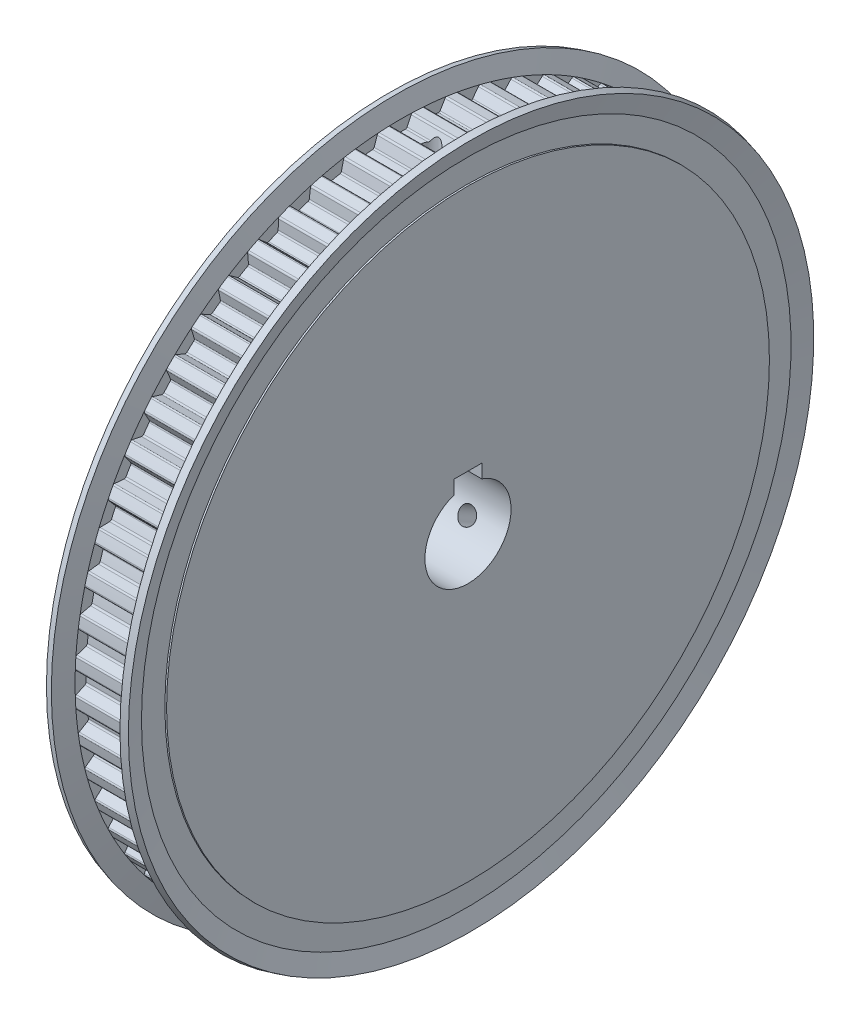
from build123d import *

# Parameters (mm, degrees)
SKETCH2_W           = 22
SKETCH2_H           = 12.5
CUT_EXTRUDE1_DEPTH  = 17
CUT_EXTRUDE2_DEPTH  = 17
CUT_EXTRUDE3_DEPTH  = 17
CUT_EXTRUDE4_DEPTH  = 17
CUT_EXTRUDE5_DEPTH  = 17
CUT_EXTRUDE6_DEPTH  = 17
CUT_EXTRUDE7_DEPTH  = 17
CUT_EXTRUDE8_DEPTH  = 17
CUT_EXTRUDE9_DEPTH  = 17
CUT_EXTRUDE10_DEPTH = 17
CUT_EXTRUDE11_DEPTH = 17
CUT_EXTRUDE12_DEPTH = 17
CUT_EXTRUDE13_DEPTH = 17
CUT_EXTRUDE14_DEPTH = 17
CUT_EXTRUDE15_DEPTH = 17
CUT_EXTRUDE16_DEPTH = 17
CUT_EXTRUDE17_DEPTH = 17
CUT_EXTRUDE18_DEPTH = 17
CUT_EXTRUDE19_DEPTH = 17
CUT_EXTRUDE20_DEPTH = 17
CUT_EXTRUDE21_DEPTH = 17
CUT_EXTRUDE22_DEPTH = 17
CUT_EXTRUDE23_DEPTH = 17
CUT_EXTRUDE24_DEPTH = 17
CUT_EXTRUDE25_DEPTH = 17
CUT_EXTRUDE26_DEPTH = 17
CUT_EXTRUDE27_DEPTH = 17
CUT_EXTRUDE28_DEPTH = 17
CUT_EXTRUDE29_DEPTH = 17
CUT_EXTRUDE30_DEPTH = 17
CUT_EXTRUDE31_DEPTH = 17
CUT_EXTRUDE32_DEPTH = 17
CUT_EXTRUDE33_DEPTH = 17
CUT_EXTRUDE34_DEPTH = 17
CUT_EXTRUDE35_DEPTH = 17
CUT_EXTRUDE36_DEPTH = 17
CUT_EXTRUDE37_DEPTH = 17
CUT_EXTRUDE38_DEPTH = 17
CUT_EXTRUDE39_DEPTH = 17
CUT_EXTRUDE40_DEPTH = 17
CUT_EXTRUDE41_DEPTH = 17
CUT_EXTRUDE42_DEPTH = 17
CUT_EXTRUDE43_DEPTH = 17
CUT_EXTRUDE44_DEPTH = 17
CUT_EXTRUDE45_DEPTH = 17
CUT_EXTRUDE46_DEPTH = 17
CUT_EXTRUDE47_DEPTH = 17
CUT_EXTRUDE48_DEPTH = 17
CUT_EXTRUDE49_DEPTH = 17
CUT_EXTRUDE50_DEPTH = 17
CUT_EXTRUDE51_DEPTH = 17
CUT_EXTRUDE52_DEPTH = 17
CUT_EXTRUDE53_DEPTH = 17
CUT_EXTRUDE54_DEPTH = 17
CUT_EXTRUDE55_DEPTH = 17
CUT_EXTRUDE56_DEPTH = 17
CUT_EXTRUDE57_DEPTH = 17
CUT_EXTRUDE58_DEPTH = 17
CUT_EXTRUDE59_DEPTH = 17
CUT_EXTRUDE60_DEPTH = 17
SKETCH63_W          = 8
SKETCH63_H          = 15.8
CUT_EXTRUDE61_DEPTH = 22
SKETCH64_W          = 2.4585
SKETCH64_H          = 94.55


with BuildPart() as part:
    # Sketch1 → Revolve1 (revolve)
    with BuildSketch(Plane.XY):
        Polygon((0, 0), (0, 87.5), (0.5, 87.5), (0.5, 94.286695005), (-0.892174751, 99.48236191), (1.039676901, 100), (2.5, 94.55), (19.5, 94.55), (20.960323099, 100), (22.892174751, 99.48236191), (21.5, 94.286695005), (21.5, 87.5), (22, 87.5), (22, 0), align=None)
    revolve(axis=Axis((22, 0, 0), (-1, 0, 0)))

    # Sketch2 → Cut-Revolve1 (revolve, cut)
    with BuildSketch(Plane.XY):
        with Locations((11, 6.25)):
            Rectangle(SKETCH2_W, SKETCH2_H)
    revolve(axis=Axis((22, 0, 0), (-1, 0, 0)), mode=Mode.SUBTRACT)

    # Sketch3 → Cut-Extrude1 (cut)
    with BuildSketch(Plane(origin=(2.5, 0, 0), x_dir=(0, 0, -1), z_dir=(1, 0, 0))):
        with BuildLine():
            Line((-3.54151607, 95.429307285), (-3.506469914, 94.484957368))
            ThreePointArc((-3.506469914, 94.484957368), (-3.2271442, 94.411906934), (-3.034773081, 94.196610457))
            Line((-3.034773081, 94.196610457), (-1.864496216, 91.686943622))
            ThreePointArc((-1.864496216, 91.686943622), (-1.639448718, 91.432177473), (-1.312093524, 91.340576474))
            ThreePointArc((-1.312093524, 91.340576474), (0.032179434, 91.349994332), (1.376445422, 91.339629395))
            ThreePointArc((1.376445422, 91.339629395), (1.649444404, 91.415864837), (1.837133226, 91.628263501))
            Line((1.837133226, 91.628263501), (3.006723314, 94.136457539))
            ThreePointArc((3.006723314, 94.136457539), (3.237749407, 94.39492376), (3.573182864, 94.482457971))
            Line((3.573182864, 94.482457971), (3.608895797, 95.426782908))
            ThreePointArc((3.608895797, 95.426782908), (0.033713499, 95.494994049), (-3.54151607, 95.429307285))
        make_face()
    extrude(amount=CUT_EXTRUDE1_DEPTH, mode=Mode.SUBTRACT)

    # Sketch4 → Cut-Extrude2 (cut)
    with BuildSketch(Plane(origin=(2.5, 0, 0), x_dir=(0, 0, -1), z_dir=(1, 0, 0))):
        with BuildLine():
            Line((6.452963567, 95.276724787), (6.389106291, 94.333884797))
            ThreePointArc((6.389106291, 94.333884797), (6.65926598, 94.232037053), (6.82807866, 93.997811736))
            Line((6.82807866, 93.997811736), (7.729613008, 91.379565875))
            ThreePointArc((7.729613008, 91.379565875), (7.926797358, 91.102671493), (8.242784355, 90.977354359))
            ThreePointArc((8.242784355, 90.977354359), (9.580677678, 90.846205838), (10.916496206, 90.695383623))
            ThreePointArc((10.916496206, 90.695383623), (11.195968445, 90.742665275), (11.404830794, 90.934281573))
            Line((11.404830794, 90.934281573), (12.830191413, 93.306480008))
            ThreePointArc((12.830191413, 93.306480008), (13.086968998, 93.539381521), (13.429714732, 93.591373866))
            Line((13.429714732, 93.591373866), (13.563940861, 94.526792675))
            ThreePointArc((13.563940861, 94.526792675), (10.015473791, 94.968338459), (6.452963567, 95.276724787))
        make_face()
    extrude(amount=CUT_EXTRUDE2_DEPTH, mode=Mode.SUBTRACT)

    # Sketch5 → Cut-Extrude3 (cut)
    with BuildSketch(Plane(origin=(2.5, 0, 0), x_dir=(0, 0, -1), z_dir=(1, 0, 0))):
        with BuildLine():
            Line((16.376743184, 94.080270555), (16.21468211, 93.149270443))
            ThreePointArc((16.21468211, 93.149270443), (16.472715848, 93.019741255), (16.616120542, 92.769153319))
            Line((16.616120542, 92.769153319), (17.239034974, 90.071014483))
            ThreePointArc((17.239034974, 90.071014483), (17.406195783, 89.77502558), (17.707352563, 89.617365311))
            ThreePointArc((17.707352563, 89.617365311), (19.024208014, 89.347087303), (20.336943573, 89.05746025))
            ThreePointArc((20.336943573, 89.05746025), (20.619827112, 89.075270084), (20.847574648, 89.244004628))
            Line((20.847574648, 89.244004628), (22.51308925, 91.454217156))
            ThreePointArc((22.51308925, 91.454217156), (22.792805018, 91.659002243), (23.139107835, 91.674883085))
            Line((23.139107835, 91.674883085), (23.370376549, 92.59114712))
            ThreePointArc((23.370376549, 92.59114712), (19.887502456, 93.40118988), (16.376743184, 94.080270555))
        make_face()
    extrude(amount=CUT_EXTRUDE3_DEPTH, mode=Mode.SUBTRACT)

    # Sketch6 → Cut-Extrude4 (cut)
    with BuildSketch(Plane(origin=(2.5, 0, 0), x_dir=(0, 0, -1), z_dir=(1, 0, 0))):
        with BuildLine():
            Line((26.121095777, 91.853053191), (25.862606479, 90.94409319))
            ThreePointArc((25.862606479, 90.94409319), (26.105687194, 90.788301707), (26.22211273, 90.524096644))
            Line((26.22211273, 90.524096644), (26.559582466, 87.775626207))
            ThreePointArc((26.559582466, 87.775626207), (26.694888285, 87.4637857), (26.977915311, 87.275509655))
            ThreePointArc((26.977915311, 87.275509655), (28.259305145, 86.869063381), (29.534575131, 86.443804705))
            ThreePointArc((29.534575131, 86.443804705), (29.817770639, 86.431947593), (30.061908113, 86.575951692))
            Line((30.061908113, 86.575951692), (31.949328971, 88.599962762))
            ThreePointArc((31.949328971, 88.599962762), (32.248918296, 88.774387757), (32.59498403, 88.7539831))
            Line((32.59498403, 88.7539831), (32.920761502, 89.641053581))
            ThreePointArc((32.920761502, 89.641053581), (29.541639482, 90.81071832), (26.121095777, 91.853053191))
        make_face()
    extrude(amount=CUT_EXTRUDE4_DEPTH, mode=Mode.SUBTRACT)

    # Sketch7 → Cut-Extrude5 (cut)
    with BuildSketch(Plane(origin=(2.5, 0, 0), x_dir=(0, 0, -1), z_dir=(1, 0, 0))):
        with BuildLine():
            Line((35.579260177, 88.619474554), (35.227174719, 87.74251342))
            ThreePointArc((35.227174719, 87.74251342), (35.452639168, 87.562166526), (35.540809964, 87.287239024))
            Line((35.540809964, 87.287239024), (35.589137614, 84.518549803))
            ThreePointArc((35.589137614, 84.518549803), (35.691106005, 84.194274281), (35.952902373, 83.977445251))
            ThreePointArc((35.952902373, 83.977445251), (37.184787415, 83.439283823), (38.408619703, 82.883052746))
            ThreePointArc((38.408619703, 82.883052746), (38.68902443, 82.841658598), (38.946877021, 82.959354512))
            Line((38.946877021, 82.959354512), (41.035525157, 84.774988636))
            ThreePointArc((41.035525157, 84.774988636), (41.351705677, 84.9171425), (41.69374276, 84.860675903))
            Line((41.69374276, 84.860675903), (42.110459702, 85.708833901))
            ThreePointArc((42.110459702, 85.708833901), (38.872112124, 87.225305525), (35.579260177, 88.619474554))
        make_face()
    extrude(amount=CUT_EXTRUDE5_DEPTH, mode=Mode.SUBTRACT)

    # Sketch8 → Cut-Extrude6 (cut)
    with BuildSketch(Plane(origin=(2.5, 0, 0), x_dir=(0, 0, -1), z_dir=(1, 0, 0))):
        with BuildLine():
            Line((44.647610758, 84.41496241), (44.205786661, 83.579608313))
            ThreePointArc((44.205786661, 83.579608313), (44.411164609, 83.376681925), (44.470114646, 83.094044147))
            Line((44.470114646, 83.094044147), (44.228770723, 80.33547048))
            ThreePointArc((44.228770723, 80.33547048), (44.296284498, 80.002312774), (44.533981913, 79.759306385))
            ThreePointArc((44.533981913, 79.759306385), (45.702865373, 79.09532601), (46.8618514, 78.414216717))
            ThreePointArc((46.8618514, 78.414216717), (47.136393174, 78.343739055), (47.405135794, 78.433837284))
            Line((47.405135794, 78.433837284), (49.672127542, 80.021201994))
            ThreePointArc((49.672127542, 80.021201994), (50.001435117, 80.129527261), (50.335696118, 80.037617383))
            Line((50.335696118, 80.037617383), (50.838786894, 80.837570301))
            ThreePointArc((50.838786894, 80.837570301), (47.776693771, 82.684234031), (44.647610758, 84.41496241))
        make_face()
    extrude(amount=CUT_EXTRUDE6_DEPTH, mode=Mode.SUBTRACT)

    # Sketch9 → Cut-Extrude7 (cut)
    with BuildSketch(Plane(origin=(2.5, 0, 0), x_dir=(0, 0, -1), z_dir=(1, 0, 0))):
        with BuildLine():
            Line((53.226792772, 79.285582272), (52.700070754, 78.500987526))
            ThreePointArc((52.700070754, 78.500987526), (52.883112036, 78.277704949), (52.912195447, 77.990453533))
            Line((52.912195447, 77.990453533), (52.383824164, 75.272218931))
            ThreePointArc((52.383824164, 75.272218931), (52.416143629, 74.933829187), (52.627137828, 74.667307866))
            ThreePointArc((52.627137828, 74.667307866), (53.720213174, 73.884783254), (54.801654847, 73.086258121))
            ThreePointArc((54.801654847, 73.086258121), (55.06732573, 72.987469113), (55.34401398, 73.048982521))
            Line((55.34401398, 73.048982521), (57.764511703, 74.390686318))
            ThreePointArc((57.764511703, 74.390686318), (58.103338371, 74.463996152), (58.426161057, 74.337649977))
            Line((58.426161057, 74.337649977), (59.010113698, 75.080633364))
            ThreePointArc((59.010113698, 75.080633364), (56.157823964, 77.237256766), (53.226792772, 79.285582272))
        make_face()
    extrude(amount=CUT_EXTRUDE7_DEPTH, mode=Mode.SUBTRACT)

    # Sketch10 → Cut-Extrude8 (cut)
    with BuildSketch(Plane(origin=(2.5, 0, 0), x_dir=(0, 0, -1), z_dir=(1, 0, 0))):
        with BuildLine():
            Line((61.222810906, 73.287532703), (60.616961843, 72.562293493))
            ThreePointArc((60.616961843, 72.562293493), (60.775661021, 72.321101057), (60.774559161, 72.03238319))
            Line((60.774559161, 72.03238319), (59.964949466, 69.3842692))
            ThreePointArc((59.964949466, 69.3842692), (59.961720521, 69.044354886), (60.143699809, 68.757238698))
            ThreePointArc((60.143699809, 68.757238698), (61.148991078, 67.864743351), (62.141039895, 66.957551186))
            ThreePointArc((62.141039895, 66.957551186), (62.394929143, 66.831533186), (62.676531567, 66.863787819))
            Line((62.676531567, 66.863787819), (65.224015786, 67.945130715))
            ThreePointArc((65.224015786, 67.945130715), (65.56864929, 67.982621919), (65.876496749, 67.823223723))
            Line((65.876496749, 67.823223723), (66.534913347, 68.501097297))
            ThreePointArc((66.534913347, 68.501097297), (63.923677285, 70.944051952), (61.222810906, 73.287532703))
        make_face()
    extrude(amount=CUT_EXTRUDE8_DEPTH, mode=Mode.SUBTRACT)

    # Sketch11 → Cut-Extrude9 (cut)
    with BuildSketch(Plane(origin=(2.5, 0, 0), x_dir=(0, 0, -1), z_dir=(1, 0, 0))):
        with BuildLine():
            Line((68.548059113, 66.48652959), (67.869720814, 65.828591787))
            ThreePointArc((67.869720814, 65.828591787), (68.002339147, 65.572132047), (67.971064087, 65.285110984))
            Line((67.971064087, 65.285110984), (66.889086233, 62.736130896))
            ThreePointArc((66.889086233, 62.736130896), (66.850344256, 62.398416185), (67.001314828, 62.093850834))
            ThreePointArc((67.001314828, 62.093850834), (67.907807839, 61.101163119), (68.799594706, 60.095243309))
            ThreePointArc((68.799594706, 60.095243309), (69.038920654, 59.943376995), (69.322351958, 59.946019465))
            Line((69.322351958, 59.946019465), (71.968911904, 60.755154041))
            ThreePointArc((71.968911904, 60.755154041), (72.315576367, 60.756415855), (72.605075756, 60.565712036))
            Line((72.605075756, 60.565712036), (73.330742563, 61.171048872))
            ThreePointArc((73.330742563, 61.171048872), (70.989169421, 63.87356926), (68.548059113, 66.48652959))
        make_face()
    extrude(amount=CUT_EXTRUDE9_DEPTH, mode=Mode.SUBTRACT)

    # Sketch12 → Cut-Extrude10 (cut)
    with BuildSketch(Plane(origin=(2.5, 0, 0), x_dir=(0, 0, -1), z_dir=(1, 0, 0))):
        with BuildLine():
            Line((75.122280438, 58.957086145), (74.37888492, 58.373658255))
            ThreePointArc((74.37888492, 58.373658255), (74.483969414, 58.104741038), (74.422863812, 57.822561439))
            Line((74.422863812, 57.822561439), (73.080372174, 55.400642413))
            ThreePointArc((73.080372174, 55.400642413), (73.00654163, 55.068827378), (73.124849421, 54.750149746))
            ThreePointArc((73.124849421, 54.750149746), (73.922612447, 53.668145757), (74.70436676, 52.57451937))
            ThreePointArc((74.70436676, 52.57451937), (74.926507303, 52.398468622), (75.208662154, 52.371469978))
            Line((75.208662154, 52.371469978), (77.925301561, 52.899531186))
            ThreePointArc((77.925301561, 52.899531186), (78.270198856, 52.864549783), (78.53817836, 52.644629734))
            Line((78.53817836, 52.644629734), (79.323144818, 53.170797636))
            ThreePointArc((79.323144818, 53.170797636), (77.276889361, 56.103274376), (75.122280438, 58.957086145))
        make_face()
    extrude(amount=CUT_EXTRUDE10_DEPTH, mode=Mode.SUBTRACT)

    # Sketch13 → Cut-Extrude11 (cut)
    with BuildSketch(Plane(origin=(2.5, 0, 0), x_dir=(0, 0, -1), z_dir=(1, 0, 0))):
        with BuildLine():
            Line((80.873446339, 50.781696527), (80.073138399, 50.279170707))
            ThreePointArc((80.073138399, 50.279170707), (80.149537725, 50.000742326), (80.059271066, 49.726495811))
            Line((80.059271066, 49.726495811), (78.470974264, 47.458172899))
            ThreePointArc((78.470974264, 47.458172899), (78.362864056, 47.135892975), (78.447212861, 46.806594561))
            ThreePointArc((78.447212861, 46.806594561), (79.127505444, 45.647128959), (79.790662139, 44.477777995))
            ThreePointArc((79.790662139, 44.477777995), (79.993183459, 44.279471662), (80.27097051, 44.223127707))
            Line((80.27097051, 44.223127707), (83.027925309, 44.464329997))
            ThreePointArc((83.027925309, 44.464329997), (83.367276668, 44.393488642), (83.610800247, 44.146761852))
            Line((83.610800247, 44.146761852), (84.446466098, 44.587996014))
            ThreePointArc((84.446466098, 44.587996014), (82.71794753, 47.718300278), (80.873446339, 50.781696527))
        make_face()
    extrude(amount=CUT_EXTRUDE11_DEPTH, mode=Mode.SUBTRACT)

    # Sketch14 → Cut-Extrude12 (cut)
    with BuildSketch(Plane(origin=(2.5, 0, 0), x_dir=(0, 0, -1), z_dir=(1, 0, 0))):
        with BuildLine():
            Line((85.738545839, 42.049932015), (84.890093817, 41.633814043))
            ThreePointArc((84.890093817, 41.633814043), (84.936970929, 41.348925018), (84.818532193, 41.085616289))
            Line((84.818532193, 41.085616289), (83.001831939, 38.995741711))
            ThreePointArc((83.001831939, 38.995741711), (82.860626544, 38.686527864), (82.910092221, 38.35021653))
            ThreePointArc((82.910092221, 38.35021653), (83.465460933, 37.125992664), (84.002754327, 35.893728777))
            ThreePointArc((84.002754327, 35.893728777), (84.183437558, 35.675339545), (84.453813314, 35.590267594))
            Line((84.453813314, 35.590267594), (87.220877731, 35.541968305))
            ThreePointArc((87.220877731, 35.541968305), (87.55096515, 35.43604315), (87.76736471, 35.165212809))
            Line((87.76736471, 35.165212809), (88.644574225, 35.516678977))
            ThreePointArc((88.644574225, 35.516678977), (87.252730557, 38.810514496), (85.738545839, 42.049932015))
        make_face()
    extrude(amount=CUT_EXTRUDE12_DEPTH, mode=Mode.SUBTRACT)

    # Sketch15 → Cut-Extrude13 (cut)
    with BuildSketch(Plane(origin=(2.5, 0, 0), x_dir=(0, 0, -1), z_dir=(1, 0, 0))):
        with BuildLine():
            Line((89.664275888, 32.857459648), (88.776975603, 32.5323086))
            ThreePointArc((88.776975603, 32.5323086), (88.793816905, 32.244080234), (88.648503732, 31.994594158))
            Line((88.648503732, 31.994594158), (86.623304174, 30.106065017))
            ThreePointArc((86.623304174, 30.106065017), (86.450550669, 29.813305059), (86.464591261, 29.473665502))
            ThreePointArc((86.464591261, 29.473665502), (86.888951365, 28.198096225), (87.294494759, 26.916420355))
            ThreePointArc((87.294494759, 26.916420355), (87.451360298, 26.680340941), (87.711362467, 26.567473061))
            Line((87.711362467, 26.567473061), (90.458219965, 26.230201369))
            ThreePointArc((90.458219965, 26.230201369), (90.775426937, 26.090352953), (90.962331558, 25.798386336))
            Line((90.962331558, 25.798386336), (91.871473846, 26.056233772))
            ThreePointArc((91.871473846, 26.056233772), (90.831554408, 29.477512596), (89.664275888, 32.857459648))
        make_face()
    extrude(amount=CUT_EXTRUDE13_DEPTH, mode=Mode.SUBTRACT)

    # Sketch16 → Cut-Extrude14 (cut)
    with BuildSketch(Plane(origin=(2.5, 0, 0), x_dir=(0, 0, -1), z_dir=(1, 0, 0))):
        with BuildLine():
            Line((92.607625366, 23.304994078), (91.691198266, 23.074372376))
            ThreePointArc((91.691198266, 23.074372376), (91.677819241, 22.78596256), (91.507223714, 22.553032557))
            Line((91.507223714, 22.553032557), (89.295713362, 20.886539974))
            ThreePointArc((89.295713362, 20.886539974), (89.09330447, 20.613441444), (89.071766145, 20.274194827))
            ThreePointArc((89.071766145, 20.274194827), (89.360468264, 18.961255542), (89.62981844, 17.644209999))
            ThreePointArc((89.62981844, 17.644209999), (89.761147634, 17.39302694), (90.007927578, 17.253599734))
            Line((90.007927578, 17.253599734), (92.704483012, 16.631050859))
            ThreePointArc((92.704483012, 16.631050859), (93.005334151, 16.458811389), (93.160696067, 16.148907343))
            Line((93.160696067, 16.148907343), (94.091810374, 16.310311018))
            ThreePointArc((94.091810374, 16.310311018), (93.415208742, 19.821548899), (92.607625366, 23.304994078))
        make_face()
    extrude(amount=CUT_EXTRUDE14_DEPTH, mode=Mode.SUBTRACT)

    # Sketch17 → Cut-Extrude15 (cut)
    with BuildSketch(Plane(origin=(2.5, 0, 0), x_dir=(0, 0, -1), z_dir=(1, 0, 0))):
        with BuildLine():
            Line((94.536346322, 13.497194116), (93.600832973, 13.3636285))
            ThreePointArc((93.600832973, 13.3636285), (93.557380206, 13.078197112), (93.363371403, 12.864375212))
            Line((93.363371403, 12.864375212), (90.989780027, 11.438177629))
            ThreePointArc((90.989780027, 11.438177629), (90.759933383, 11.187732651), (90.703052119, 10.852595831))
            ThreePointArc((90.703052119, 10.852595831), (90.852933172, 9.516671376), (90.983139073, 8.178685986))
            ThreePointArc((90.983139073, 8.178685986), (91.087493053, 7.915151295), (91.318346999, 7.750692358))
            Line((91.318346999, 7.750692358), (93.935056343, 6.849687075))
            ThreePointArc((93.935056343, 6.849687075), (94.216255461, 6.646943644), (94.338372494, 6.322497543))
            Line((94.338372494, 6.322497543), (95.281257338, 6.385689083))
            ThreePointArc((95.281257338, 6.385689083), (94.9753865, 9.948416164), (94.536346322, 13.497194116))
        make_face()
    extrude(amount=CUT_EXTRUDE15_DEPTH, mode=Mode.SUBTRACT)

    # Sketch18 → Cut-Extrude16 (cut)
    with BuildSketch(Plane(origin=(2.5, 0, 0), x_dir=(0, 0, -1), z_dir=(1, 0, 0))):
        with BuildLine():
            Line((95.429307285, 3.54151607), (94.484957368, 3.506469914))
            ThreePointArc((94.484957368, 3.506469914), (94.411906934, 3.2271442), (94.196610457, 3.034773081))
            Line((94.196610457, 3.034773081), (91.686943622, 1.864496216))
            ThreePointArc((91.686943622, 1.864496216), (91.432177473, 1.639448718), (91.340576474, 1.312093524))
            ThreePointArc((91.340576474, 1.312093524), (91.349994332, -0.032179434), (91.339629395, -1.376445422))
            ThreePointArc((91.339629395, -1.376445422), (91.415864837, -1.649444404), (91.628263501, -1.837133226))
            Line((91.628263501, -1.837133226), (94.136457539, -3.006723314))
            ThreePointArc((94.136457539, -3.006723314), (94.39492376, -3.237749407), (94.482457971, -3.573182864))
            Line((94.482457971, -3.573182864), (95.426782908, -3.608895797))
            ThreePointArc((95.426782908, -3.608895797), (95.494994049, -0.033713499), (95.429307285, 3.54151607))
        make_face()
    extrude(amount=CUT_EXTRUDE16_DEPTH, mode=Mode.SUBTRACT)

    # Sketch19 → Cut-Extrude17 (cut)
    with BuildSketch(Plane(origin=(2.5, 0, 0), x_dir=(0, 0, -1), z_dir=(1, 0, 0))):
        with BuildLine():
            Line((95.276724787, -6.452963567), (94.333884797, -6.389106291))
            ThreePointArc((94.333884797, -6.389106291), (94.232037053, -6.65926598), (93.997811736, -6.82807866))
            Line((93.997811736, -6.82807866), (91.379565875, -7.729613008))
            ThreePointArc((91.379565875, -7.729613008), (91.102671493, -7.926797358), (90.977354359, -8.242784355))
            ThreePointArc((90.977354359, -8.242784355), (90.846205838, -9.580677678), (90.695383623, -10.916496206))
            ThreePointArc((90.695383623, -10.916496206), (90.742665275, -11.195968445), (90.934281573, -11.404830794))
            Line((90.934281573, -11.404830794), (93.306480008, -12.830191413))
            ThreePointArc((93.306480008, -12.830191413), (93.539381521, -13.086968998), (93.591373866, -13.429714732))
            Line((93.591373866, -13.429714732), (94.526792675, -13.563940861))
            ThreePointArc((94.526792675, -13.563940861), (94.968338459, -10.015473791), (95.276724787, -6.452963567))
        make_face()
    extrude(amount=CUT_EXTRUDE17_DEPTH, mode=Mode.SUBTRACT)

    # Sketch20 → Cut-Extrude18 (cut)
    with BuildSketch(Plane(origin=(2.5, 0, 0), x_dir=(0, 0, -1), z_dir=(1, 0, 0))):
        with BuildLine():
            Line((94.080270555, -16.376743184), (93.149270443, -16.21468211))
            ThreePointArc((93.149270443, -16.21468211), (93.019741255, -16.472715848), (92.769153319, -16.616120542))
            Line((92.769153319, -16.616120542), (90.071014483, -17.239034974))
            ThreePointArc((90.071014483, -17.239034974), (89.77502558, -17.406195783), (89.617365311, -17.707352563))
            ThreePointArc((89.617365311, -17.707352563), (89.347087303, -19.024208014), (89.05746025, -20.336943573))
            ThreePointArc((89.05746025, -20.336943573), (89.075270084, -20.619827112), (89.244004628, -20.847574648))
            Line((89.244004628, -20.847574648), (91.454217156, -22.51308925))
            ThreePointArc((91.454217156, -22.51308925), (91.659002243, -22.792805018), (91.674883085, -23.139107835))
            Line((91.674883085, -23.139107835), (92.59114712, -23.370376549))
            ThreePointArc((92.59114712, -23.370376549), (93.40118988, -19.887502456), (94.080270555, -16.376743184))
        make_face()
    extrude(amount=CUT_EXTRUDE18_DEPTH, mode=Mode.SUBTRACT)

    # Sketch21 → Cut-Extrude19 (cut)
    with BuildSketch(Plane(origin=(2.5, 0, 0), x_dir=(0, 0, -1), z_dir=(1, 0, 0))):
        with BuildLine():
            Line((91.853053191, -26.121095777), (90.94409319, -25.862606479))
            ThreePointArc((90.94409319, -25.862606479), (90.788301707, -26.105687194), (90.524096644, -26.22211273))
            Line((90.524096644, -26.22211273), (87.775626207, -26.559582466))
            ThreePointArc((87.775626207, -26.559582466), (87.4637857, -26.694888285), (87.275509655, -26.977915311))
            ThreePointArc((87.275509655, -26.977915311), (86.869063381, -28.259305145), (86.443804705, -29.534575131))
            ThreePointArc((86.443804705, -29.534575131), (86.431947593, -29.817770639), (86.575951692, -30.061908113))
            Line((86.575951692, -30.061908113), (88.599962762, -31.949328971))
            ThreePointArc((88.599962762, -31.949328971), (88.774387757, -32.248918296), (88.7539831, -32.59498403))
            Line((88.7539831, -32.59498403), (89.641053581, -32.920761502))
            ThreePointArc((89.641053581, -32.920761502), (90.81071832, -29.541639482), (91.853053191, -26.121095777))
        make_face()
    extrude(amount=CUT_EXTRUDE19_DEPTH, mode=Mode.SUBTRACT)

    # Sketch22 → Cut-Extrude20 (cut)
    with BuildSketch(Plane(origin=(2.5, 0, 0), x_dir=(0, 0, -1), z_dir=(1, 0, 0))):
        with BuildLine():
            Line((88.619474554, -35.579260177), (87.74251342, -35.227174719))
            ThreePointArc((87.74251342, -35.227174719), (87.562166526, -35.452639168), (87.287239024, -35.540809964))
            Line((87.287239024, -35.540809964), (84.518549803, -35.589137614))
            ThreePointArc((84.518549803, -35.589137614), (84.194274281, -35.691106005), (83.977445251, -35.952902373))
            ThreePointArc((83.977445251, -35.952902373), (83.439283823, -37.184787415), (82.883052746, -38.408619703))
            ThreePointArc((82.883052746, -38.408619703), (82.841658598, -38.68902443), (82.959354512, -38.946877021))
            Line((82.959354512, -38.946877021), (84.774988636, -41.035525157))
            ThreePointArc((84.774988636, -41.035525157), (84.9171425, -41.351705677), (84.860675903, -41.69374276))
            Line((84.860675903, -41.69374276), (85.708833901, -42.110459702))
            ThreePointArc((85.708833901, -42.110459702), (87.225305525, -38.872112124), (88.619474554, -35.579260177))
        make_face()
    extrude(amount=CUT_EXTRUDE20_DEPTH, mode=Mode.SUBTRACT)

    # Sketch23 → Cut-Extrude21 (cut)
    with BuildSketch(Plane(origin=(2.5, 0, 0), x_dir=(0, 0, -1), z_dir=(1, 0, 0))):
        with BuildLine():
            Line((84.41496241, -44.647610758), (83.579608313, -44.205786661))
            ThreePointArc((83.579608313, -44.205786661), (83.376681925, -44.411164609), (83.094044147, -44.470114646))
            Line((83.094044147, -44.470114646), (80.33547048, -44.228770723))
            ThreePointArc((80.33547048, -44.228770723), (80.002312774, -44.296284498), (79.759306385, -44.533981913))
            ThreePointArc((79.759306385, -44.533981913), (79.09532601, -45.702865373), (78.414216717, -46.8618514))
            ThreePointArc((78.414216717, -46.8618514), (78.343739055, -47.136393174), (78.433837284, -47.405135794))
            Line((78.433837284, -47.405135794), (80.021201994, -49.672127542))
            ThreePointArc((80.021201994, -49.672127542), (80.129527261, -50.001435117), (80.037617383, -50.335696118))
            Line((80.037617383, -50.335696118), (80.837570301, -50.838786894))
            ThreePointArc((80.837570301, -50.838786894), (82.684234031, -47.776693771), (84.41496241, -44.647610758))
        make_face()
    extrude(amount=CUT_EXTRUDE21_DEPTH, mode=Mode.SUBTRACT)

    # Sketch24 → Cut-Extrude22 (cut)
    with BuildSketch(Plane(origin=(2.5, 0, 0), x_dir=(0, 0, -1), z_dir=(1, 0, 0))):
        with BuildLine():
            Line((79.285582272, -53.226792772), (78.500987526, -52.700070754))
            ThreePointArc((78.500987526, -52.700070754), (78.277704949, -52.883112036), (77.990453533, -52.912195447))
            Line((77.990453533, -52.912195447), (75.272218931, -52.383824164))
            ThreePointArc((75.272218931, -52.383824164), (74.933829187, -52.416143629), (74.667307866, -52.627137828))
            ThreePointArc((74.667307866, -52.627137828), (73.884783254, -53.720213174), (73.086258121, -54.801654847))
            ThreePointArc((73.086258121, -54.801654847), (72.987469113, -55.06732573), (73.048982521, -55.34401398))
            Line((73.048982521, -55.34401398), (74.390686318, -57.764511703))
            ThreePointArc((74.390686318, -57.764511703), (74.463996152, -58.103338371), (74.337649977, -58.426161057))
            Line((74.337649977, -58.426161057), (75.080633364, -59.010113698))
            ThreePointArc((75.080633364, -59.010113698), (77.237256766, -56.157823964), (79.285582272, -53.226792772))
        make_face()
    extrude(amount=CUT_EXTRUDE22_DEPTH, mode=Mode.SUBTRACT)

    # Sketch25 → Cut-Extrude23 (cut)
    with BuildSketch(Plane(origin=(2.5, 0, 0), x_dir=(0, 0, -1), z_dir=(1, 0, 0))):
        with BuildLine():
            Line((73.287532703, -61.222810906), (72.562293493, -60.616961843))
            ThreePointArc((72.562293493, -60.616961843), (72.321101057, -60.775661021), (72.03238319, -60.774559161))
            Line((72.03238319, -60.774559161), (69.3842692, -59.964949466))
            ThreePointArc((69.3842692, -59.964949466), (69.044354886, -59.961720521), (68.757238698, -60.143699809))
            ThreePointArc((68.757238698, -60.143699809), (67.864743351, -61.148991078), (66.957551186, -62.141039895))
            ThreePointArc((66.957551186, -62.141039895), (66.831533186, -62.394929143), (66.863787819, -62.676531567))
            Line((66.863787819, -62.676531567), (67.945130715, -65.224015786))
            ThreePointArc((67.945130715, -65.224015786), (67.982621919, -65.56864929), (67.823223723, -65.876496749))
            Line((67.823223723, -65.876496749), (68.501097297, -66.534913347))
            ThreePointArc((68.501097297, -66.534913347), (70.944051952, -63.923677285), (73.287532703, -61.222810906))
        make_face()
    extrude(amount=CUT_EXTRUDE23_DEPTH, mode=Mode.SUBTRACT)

    # Sketch26 → Cut-Extrude24 (cut)
    with BuildSketch(Plane(origin=(2.5, 0, 0), x_dir=(0, 0, -1), z_dir=(1, 0, 0))):
        with BuildLine():
            Line((66.48652959, -68.548059113), (65.828591787, -67.869720814))
            ThreePointArc((65.828591787, -67.869720814), (65.572132047, -68.002339147), (65.285110984, -67.971064087))
            Line((65.285110984, -67.971064087), (62.736130896, -66.889086233))
            ThreePointArc((62.736130896, -66.889086233), (62.398416185, -66.850344256), (62.093850834, -67.001314828))
            ThreePointArc((62.093850834, -67.001314828), (61.101163119, -67.907807839), (60.095243309, -68.799594706))
            ThreePointArc((60.095243309, -68.799594706), (59.943376995, -69.038920654), (59.946019465, -69.322351958))
            Line((59.946019465, -69.322351958), (60.755154041, -71.968911904))
            ThreePointArc((60.755154041, -71.968911904), (60.756415855, -72.315576367), (60.565712036, -72.605075756))
            Line((60.565712036, -72.605075756), (61.171048872, -73.330742563))
            ThreePointArc((61.171048872, -73.330742563), (63.87356926, -70.989169421), (66.48652959, -68.548059113))
        make_face()
    extrude(amount=CUT_EXTRUDE24_DEPTH, mode=Mode.SUBTRACT)

    # Sketch27 → Cut-Extrude25 (cut)
    with BuildSketch(Plane(origin=(2.5, 0, 0), x_dir=(0, 0, -1), z_dir=(1, 0, 0))):
        with BuildLine():
            Line((58.957086145, -75.122280438), (58.373658255, -74.37888492))
            ThreePointArc((58.373658255, -74.37888492), (58.104741038, -74.483969414), (57.822561439, -74.422863812))
            Line((57.822561439, -74.422863812), (55.400642413, -73.080372174))
            ThreePointArc((55.400642413, -73.080372174), (55.068827378, -73.00654163), (54.750149746, -73.124849421))
            ThreePointArc((54.750149746, -73.124849421), (53.668145757, -73.922612447), (52.57451937, -74.70436676))
            ThreePointArc((52.57451937, -74.70436676), (52.398468622, -74.926507303), (52.371469978, -75.208662154))
            Line((52.371469978, -75.208662154), (52.899531186, -77.925301561))
            ThreePointArc((52.899531186, -77.925301561), (52.864549783, -78.270198856), (52.644629734, -78.53817836))
            Line((52.644629734, -78.53817836), (53.170797636, -79.323144818))
            ThreePointArc((53.170797636, -79.323144818), (56.103274376, -77.276889361), (58.957086145, -75.122280438))
        make_face()
    extrude(amount=CUT_EXTRUDE25_DEPTH, mode=Mode.SUBTRACT)

    # Sketch28 → Cut-Extrude26 (cut)
    with BuildSketch(Plane(origin=(2.5, 0, 0), x_dir=(0, 0, -1), z_dir=(1, 0, 0))):
        with BuildLine():
            Line((50.781696527, -80.873446339), (50.279170707, -80.073138399))
            ThreePointArc((50.279170707, -80.073138399), (50.000742326, -80.149537725), (49.726495811, -80.059271066))
            Line((49.726495811, -80.059271066), (47.458172899, -78.470974264))
            ThreePointArc((47.458172899, -78.470974264), (47.135892975, -78.362864056), (46.806594561, -78.447212861))
            ThreePointArc((46.806594561, -78.447212861), (45.647128959, -79.127505444), (44.477777995, -79.790662139))
            ThreePointArc((44.477777995, -79.790662139), (44.279471662, -79.993183459), (44.223127707, -80.27097051))
            Line((44.223127707, -80.27097051), (44.464329997, -83.027925309))
            ThreePointArc((44.464329997, -83.027925309), (44.393488642, -83.367276668), (44.146761852, -83.610800247))
            Line((44.146761852, -83.610800247), (44.587996014, -84.446466098))
            ThreePointArc((44.587996014, -84.446466098), (47.718300278, -82.71794753), (50.781696527, -80.873446339))
        make_face()
    extrude(amount=CUT_EXTRUDE26_DEPTH, mode=Mode.SUBTRACT)

    # Sketch29 → Cut-Extrude27 (cut)
    with BuildSketch(Plane(origin=(2.5, 0, 0), x_dir=(0, 0, -1), z_dir=(1, 0, 0))):
        with BuildLine():
            Line((42.049932015, -85.738545839), (41.633814043, -84.890093817))
            ThreePointArc((41.633814043, -84.890093817), (41.348925018, -84.936970929), (41.085616289, -84.818532193))
            Line((41.085616289, -84.818532193), (38.995741711, -83.001831939))
            ThreePointArc((38.995741711, -83.001831939), (38.686527864, -82.860626544), (38.35021653, -82.910092221))
            ThreePointArc((38.35021653, -82.910092221), (37.125992664, -83.465460933), (35.893728777, -84.002754327))
            ThreePointArc((35.893728777, -84.002754327), (35.675339545, -84.183437558), (35.590267594, -84.453813314))
            Line((35.590267594, -84.453813314), (35.541968305, -87.220877731))
            ThreePointArc((35.541968305, -87.220877731), (35.43604315, -87.55096515), (35.165212809, -87.76736471))
            Line((35.165212809, -87.76736471), (35.516678977, -88.644574225))
            ThreePointArc((35.516678977, -88.644574225), (38.810514496, -87.252730557), (42.049932015, -85.738545839))
        make_face()
    extrude(amount=CUT_EXTRUDE27_DEPTH, mode=Mode.SUBTRACT)

    # Sketch30 → Cut-Extrude28 (cut)
    with BuildSketch(Plane(origin=(2.5, 0, 0), x_dir=(0, 0, -1), z_dir=(1, 0, 0))):
        with BuildLine():
            Line((32.857459648, -89.664275888), (32.5323086, -88.776975603))
            ThreePointArc((32.5323086, -88.776975603), (32.244080234, -88.793816905), (31.994594158, -88.648503732))
            Line((31.994594158, -88.648503732), (30.106065017, -86.623304174))
            ThreePointArc((30.106065017, -86.623304174), (29.813305059, -86.450550669), (29.473665502, -86.464591261))
            ThreePointArc((29.473665502, -86.464591261), (28.198096225, -86.888951365), (26.916420355, -87.294494759))
            ThreePointArc((26.916420355, -87.294494759), (26.680340941, -87.451360298), (26.567473061, -87.711362467))
            Line((26.567473061, -87.711362467), (26.230201369, -90.458219965))
            ThreePointArc((26.230201369, -90.458219965), (26.090352953, -90.775426937), (25.798386336, -90.962331558))
            Line((25.798386336, -90.962331558), (26.056233772, -91.871473846))
            ThreePointArc((26.056233772, -91.871473846), (29.477512596, -90.831554408), (32.857459648, -89.664275888))
        make_face()
    extrude(amount=CUT_EXTRUDE28_DEPTH, mode=Mode.SUBTRACT)

    # Sketch31 → Cut-Extrude29 (cut)
    with BuildSketch(Plane(origin=(2.5, 0, 0), x_dir=(0, 0, -1), z_dir=(1, 0, 0))):
        with BuildLine():
            Line((23.304994078, -92.607625366), (23.074372376, -91.691198266))
            ThreePointArc((23.074372376, -91.691198266), (22.78596256, -91.677819241), (22.553032557, -91.507223714))
            Line((22.553032557, -91.507223714), (20.886539974, -89.295713362))
            ThreePointArc((20.886539974, -89.295713362), (20.613441444, -89.09330447), (20.274194827, -89.071766145))
            ThreePointArc((20.274194827, -89.071766145), (18.961255542, -89.360468264), (17.644209999, -89.62981844))
            ThreePointArc((17.644209999, -89.62981844), (17.39302694, -89.761147634), (17.253599734, -90.007927578))
            Line((17.253599734, -90.007927578), (16.631050859, -92.704483012))
            ThreePointArc((16.631050859, -92.704483012), (16.458811389, -93.005334151), (16.148907343, -93.160696067))
            Line((16.148907343, -93.160696067), (16.310311018, -94.091810374))
            ThreePointArc((16.310311018, -94.091810374), (19.821548899, -93.415208742), (23.304994078, -92.607625366))
        make_face()
    extrude(amount=CUT_EXTRUDE29_DEPTH, mode=Mode.SUBTRACT)

    # Sketch32 → Cut-Extrude30 (cut)
    with BuildSketch(Plane(origin=(2.5, 0, 0), x_dir=(0, 0, -1), z_dir=(1, 0, 0))):
        with BuildLine():
            Line((13.497194116, -94.536346322), (13.3636285, -93.600832973))
            ThreePointArc((13.3636285, -93.600832973), (13.078197112, -93.557380206), (12.864375212, -93.363371403))
            Line((12.864375212, -93.363371403), (11.438177629, -90.989780027))
            ThreePointArc((11.438177629, -90.989780027), (11.187732651, -90.759933383), (10.852595831, -90.703052119))
            ThreePointArc((10.852595831, -90.703052119), (9.516671376, -90.852933172), (8.178685986, -90.983139073))
            ThreePointArc((8.178685986, -90.983139073), (7.915151295, -91.087493053), (7.750692358, -91.318346999))
            Line((7.750692358, -91.318346999), (6.849687075, -93.935056343))
            ThreePointArc((6.849687075, -93.935056343), (6.646943644, -94.216255461), (6.322497543, -94.338372494))
            Line((6.322497543, -94.338372494), (6.385689083, -95.281257338))
            ThreePointArc((6.385689083, -95.281257338), (9.948416164, -94.9753865), (13.497194116, -94.536346322))
        make_face()
    extrude(amount=CUT_EXTRUDE30_DEPTH, mode=Mode.SUBTRACT)

    # Sketch33 → Cut-Extrude31 (cut)
    with BuildSketch(Plane(origin=(2.5, 0, 0), x_dir=(0, 0, -1), z_dir=(1, 0, 0))):
        with BuildLine():
            Line((3.54151607, -95.429307285), (3.506469914, -94.484957368))
            ThreePointArc((3.506469914, -94.484957368), (3.2271442, -94.411906934), (3.034773081, -94.196610457))
            Line((3.034773081, -94.196610457), (1.864496216, -91.686943622))
            ThreePointArc((1.864496216, -91.686943622), (1.639448718, -91.432177473), (1.312093524, -91.340576474))
            ThreePointArc((1.312093524, -91.340576474), (-0.032179434, -91.349994332), (-1.376445422, -91.339629395))
            ThreePointArc((-1.376445422, -91.339629395), (-1.649444404, -91.415864837), (-1.837133226, -91.628263501))
            Line((-1.837133226, -91.628263501), (-3.006723314, -94.136457539))
            ThreePointArc((-3.006723314, -94.136457539), (-3.237749407, -94.39492376), (-3.573182864, -94.482457971))
            Line((-3.573182864, -94.482457971), (-3.608895797, -95.426782908))
            ThreePointArc((-3.608895797, -95.426782908), (-0.033713499, -95.494994049), (3.54151607, -95.429307285))
        make_face()
    extrude(amount=CUT_EXTRUDE31_DEPTH, mode=Mode.SUBTRACT)

    # Sketch34 → Cut-Extrude32 (cut)
    with BuildSketch(Plane(origin=(2.5, 0, 0), x_dir=(0, 0, -1), z_dir=(1, 0, 0))):
        with BuildLine():
            Line((-6.452963567, -95.276724787), (-6.389106291, -94.333884797))
            ThreePointArc((-6.389106291, -94.333884797), (-6.65926598, -94.232037053), (-6.82807866, -93.997811736))
            Line((-6.82807866, -93.997811736), (-7.729613008, -91.379565875))
            ThreePointArc((-7.729613008, -91.379565875), (-7.926797358, -91.102671493), (-8.242784355, -90.977354359))
            ThreePointArc((-8.242784355, -90.977354359), (-9.580677678, -90.846205838), (-10.916496206, -90.695383623))
            ThreePointArc((-10.916496206, -90.695383623), (-11.195968445, -90.742665275), (-11.404830794, -90.934281573))
            Line((-11.404830794, -90.934281573), (-12.830191413, -93.306480008))
            ThreePointArc((-12.830191413, -93.306480008), (-13.086968998, -93.539381521), (-13.429714732, -93.591373866))
            Line((-13.429714732, -93.591373866), (-13.563940861, -94.526792675))
            ThreePointArc((-13.563940861, -94.526792675), (-10.015473791, -94.968338459), (-6.452963567, -95.276724787))
        make_face()
    extrude(amount=CUT_EXTRUDE32_DEPTH, mode=Mode.SUBTRACT)

    # Sketch35 → Cut-Extrude33 (cut)
    with BuildSketch(Plane(origin=(2.5, 0, 0), x_dir=(0, 0, -1), z_dir=(1, 0, 0))):
        with BuildLine():
            Line((-16.376743184, -94.080270555), (-16.21468211, -93.149270443))
            ThreePointArc((-16.21468211, -93.149270443), (-16.472715848, -93.019741255), (-16.616120542, -92.769153319))
            Line((-16.616120542, -92.769153319), (-17.239034974, -90.071014483))
            ThreePointArc((-17.239034974, -90.071014483), (-17.406195783, -89.77502558), (-17.707352563, -89.617365311))
            ThreePointArc((-17.707352563, -89.617365311), (-19.024208014, -89.347087303), (-20.336943573, -89.05746025))
            ThreePointArc((-20.336943573, -89.05746025), (-20.619827112, -89.075270084), (-20.847574648, -89.244004628))
            Line((-20.847574648, -89.244004628), (-22.51308925, -91.454217156))
            ThreePointArc((-22.51308925, -91.454217156), (-22.792805018, -91.659002243), (-23.139107835, -91.674883085))
            Line((-23.139107835, -91.674883085), (-23.370376549, -92.59114712))
            ThreePointArc((-23.370376549, -92.59114712), (-19.887502456, -93.40118988), (-16.376743184, -94.080270555))
        make_face()
    extrude(amount=CUT_EXTRUDE33_DEPTH, mode=Mode.SUBTRACT)

    # Sketch36 → Cut-Extrude34 (cut)
    with BuildSketch(Plane(origin=(2.5, 0, 0), x_dir=(0, 0, -1), z_dir=(1, 0, 0))):
        with BuildLine():
            Line((-26.121095777, -91.853053191), (-25.862606479, -90.94409319))
            ThreePointArc((-25.862606479, -90.94409319), (-26.105687194, -90.788301707), (-26.22211273, -90.524096644))
            Line((-26.22211273, -90.524096644), (-26.559582466, -87.775626207))
            ThreePointArc((-26.559582466, -87.775626207), (-26.694888285, -87.4637857), (-26.977915311, -87.275509655))
            ThreePointArc((-26.977915311, -87.275509655), (-28.259305145, -86.869063381), (-29.534575131, -86.443804705))
            ThreePointArc((-29.534575131, -86.443804705), (-29.817770639, -86.431947593), (-30.061908113, -86.575951692))
            Line((-30.061908113, -86.575951692), (-31.949328971, -88.599962762))
            ThreePointArc((-31.949328971, -88.599962762), (-32.248918296, -88.774387757), (-32.59498403, -88.7539831))
            Line((-32.59498403, -88.7539831), (-32.920761502, -89.641053581))
            ThreePointArc((-32.920761502, -89.641053581), (-29.541639482, -90.81071832), (-26.121095777, -91.853053191))
        make_face()
    extrude(amount=CUT_EXTRUDE34_DEPTH, mode=Mode.SUBTRACT)

    # Sketch37 → Cut-Extrude35 (cut)
    with BuildSketch(Plane(origin=(2.5, 0, 0), x_dir=(0, 0, -1), z_dir=(1, 0, 0))):
        with BuildLine():
            Line((-35.579260177, -88.619474554), (-35.227174719, -87.74251342))
            ThreePointArc((-35.227174719, -87.74251342), (-35.452639168, -87.562166526), (-35.540809964, -87.287239024))
            Line((-35.540809964, -87.287239024), (-35.589137614, -84.518549803))
            ThreePointArc((-35.589137614, -84.518549803), (-35.691106005, -84.194274281), (-35.952902373, -83.977445251))
            ThreePointArc((-35.952902373, -83.977445251), (-37.184787415, -83.439283823), (-38.408619703, -82.883052746))
            ThreePointArc((-38.408619703, -82.883052746), (-38.68902443, -82.841658598), (-38.946877021, -82.959354512))
            Line((-38.946877021, -82.959354512), (-41.035525157, -84.774988636))
            ThreePointArc((-41.035525157, -84.774988636), (-41.351705677, -84.9171425), (-41.69374276, -84.860675903))
            Line((-41.69374276, -84.860675903), (-42.110459702, -85.708833901))
            ThreePointArc((-42.110459702, -85.708833901), (-38.872112124, -87.225305525), (-35.579260177, -88.619474554))
        make_face()
    extrude(amount=CUT_EXTRUDE35_DEPTH, mode=Mode.SUBTRACT)

    # Sketch38 → Cut-Extrude36 (cut)
    with BuildSketch(Plane(origin=(2.5, 0, 0), x_dir=(0, 0, -1), z_dir=(1, 0, 0))):
        with BuildLine():
            Line((-44.647610758, -84.41496241), (-44.205786661, -83.579608313))
            ThreePointArc((-44.205786661, -83.579608313), (-44.411164609, -83.376681925), (-44.470114646, -83.094044147))
            Line((-44.470114646, -83.094044147), (-44.228770723, -80.33547048))
            ThreePointArc((-44.228770723, -80.33547048), (-44.296284498, -80.002312774), (-44.533981913, -79.759306385))
            ThreePointArc((-44.533981913, -79.759306385), (-45.702865373, -79.09532601), (-46.8618514, -78.414216717))
            ThreePointArc((-46.8618514, -78.414216717), (-47.136393174, -78.343739055), (-47.405135794, -78.433837284))
            Line((-47.405135794, -78.433837284), (-49.672127542, -80.021201994))
            ThreePointArc((-49.672127542, -80.021201994), (-50.001435117, -80.129527261), (-50.335696118, -80.037617383))
            Line((-50.335696118, -80.037617383), (-50.838786894, -80.837570301))
            ThreePointArc((-50.838786894, -80.837570301), (-47.776693771, -82.684234031), (-44.647610758, -84.41496241))
        make_face()
    extrude(amount=CUT_EXTRUDE36_DEPTH, mode=Mode.SUBTRACT)

    # Sketch39 → Cut-Extrude37 (cut)
    with BuildSketch(Plane(origin=(2.5, 0, 0), x_dir=(0, 0, -1), z_dir=(1, 0, 0))):
        with BuildLine():
            Line((-53.226792772, -79.285582272), (-52.700070754, -78.500987526))
            ThreePointArc((-52.700070754, -78.500987526), (-52.883112036, -78.277704949), (-52.912195447, -77.990453533))
            Line((-52.912195447, -77.990453533), (-52.383824164, -75.272218931))
            ThreePointArc((-52.383824164, -75.272218931), (-52.416143629, -74.933829187), (-52.627137828, -74.667307866))
            ThreePointArc((-52.627137828, -74.667307866), (-53.720213174, -73.884783254), (-54.801654847, -73.086258121))
            ThreePointArc((-54.801654847, -73.086258121), (-55.06732573, -72.987469113), (-55.34401398, -73.048982521))
            Line((-55.34401398, -73.048982521), (-57.764511703, -74.390686318))
            ThreePointArc((-57.764511703, -74.390686318), (-58.103338371, -74.463996152), (-58.426161057, -74.337649977))
            Line((-58.426161057, -74.337649977), (-59.010113698, -75.080633364))
            ThreePointArc((-59.010113698, -75.080633364), (-56.157823964, -77.237256766), (-53.226792772, -79.285582272))
        make_face()
    extrude(amount=CUT_EXTRUDE37_DEPTH, mode=Mode.SUBTRACT)

    # Sketch40 → Cut-Extrude38 (cut)
    with BuildSketch(Plane(origin=(2.5, 0, 0), x_dir=(0, 0, -1), z_dir=(1, 0, 0))):
        with BuildLine():
            Line((-61.222810906, -73.287532703), (-60.616961843, -72.562293493))
            ThreePointArc((-60.616961843, -72.562293493), (-60.775661021, -72.321101057), (-60.774559161, -72.03238319))
            Line((-60.774559161, -72.03238319), (-59.964949466, -69.3842692))
            ThreePointArc((-59.964949466, -69.3842692), (-59.961720521, -69.044354886), (-60.143699809, -68.757238698))
            ThreePointArc((-60.143699809, -68.757238698), (-61.148991078, -67.864743351), (-62.141039895, -66.957551186))
            ThreePointArc((-62.141039895, -66.957551186), (-62.394929143, -66.831533186), (-62.676531567, -66.863787819))
            Line((-62.676531567, -66.863787819), (-65.224015786, -67.945130715))
            ThreePointArc((-65.224015786, -67.945130715), (-65.56864929, -67.982621919), (-65.876496749, -67.823223723))
            Line((-65.876496749, -67.823223723), (-66.534913347, -68.501097297))
            ThreePointArc((-66.534913347, -68.501097297), (-63.923677285, -70.944051952), (-61.222810906, -73.287532703))
        make_face()
    extrude(amount=CUT_EXTRUDE38_DEPTH, mode=Mode.SUBTRACT)

    # Sketch41 → Cut-Extrude39 (cut)
    with BuildSketch(Plane(origin=(2.5, 0, 0), x_dir=(0, 0, -1), z_dir=(1, 0, 0))):
        with BuildLine():
            Line((-68.548059113, -66.48652959), (-67.869720814, -65.828591787))
            ThreePointArc((-67.869720814, -65.828591787), (-68.002339147, -65.572132047), (-67.971064087, -65.285110984))
            Line((-67.971064087, -65.285110984), (-66.889086233, -62.736130896))
            ThreePointArc((-66.889086233, -62.736130896), (-66.850344256, -62.398416185), (-67.001314828, -62.093850834))
            ThreePointArc((-67.001314828, -62.093850834), (-67.907807839, -61.101163119), (-68.799594706, -60.095243309))
            ThreePointArc((-68.799594706, -60.095243309), (-69.038920654, -59.943376995), (-69.322351958, -59.946019465))
            Line((-69.322351958, -59.946019465), (-71.968911904, -60.755154041))
            ThreePointArc((-71.968911904, -60.755154041), (-72.315576367, -60.756415855), (-72.605075756, -60.565712036))
            Line((-72.605075756, -60.565712036), (-73.330742563, -61.171048872))
            ThreePointArc((-73.330742563, -61.171048872), (-70.989169421, -63.87356926), (-68.548059113, -66.48652959))
        make_face()
    extrude(amount=CUT_EXTRUDE39_DEPTH, mode=Mode.SUBTRACT)

    # Sketch42 → Cut-Extrude40 (cut)
    with BuildSketch(Plane(origin=(2.5, 0, 0), x_dir=(0, 0, -1), z_dir=(1, 0, 0))):
        with BuildLine():
            Line((-75.122280438, -58.957086145), (-74.37888492, -58.373658255))
            ThreePointArc((-74.37888492, -58.373658255), (-74.483969414, -58.104741038), (-74.422863812, -57.822561439))
            Line((-74.422863812, -57.822561439), (-73.080372174, -55.400642413))
            ThreePointArc((-73.080372174, -55.400642413), (-73.00654163, -55.068827378), (-73.124849421, -54.750149746))
            ThreePointArc((-73.124849421, -54.750149746), (-73.922612447, -53.668145757), (-74.70436676, -52.57451937))
            ThreePointArc((-74.70436676, -52.57451937), (-74.926507303, -52.398468622), (-75.208662154, -52.371469978))
            Line((-75.208662154, -52.371469978), (-77.925301561, -52.899531186))
            ThreePointArc((-77.925301561, -52.899531186), (-78.270198856, -52.864549783), (-78.53817836, -52.644629734))
            Line((-78.53817836, -52.644629734), (-79.323144818, -53.170797636))
            ThreePointArc((-79.323144818, -53.170797636), (-77.276889361, -56.103274376), (-75.122280438, -58.957086145))
        make_face()
    extrude(amount=CUT_EXTRUDE40_DEPTH, mode=Mode.SUBTRACT)

    # Sketch43 → Cut-Extrude41 (cut)
    with BuildSketch(Plane(origin=(2.5, 0, 0), x_dir=(0, 0, -1), z_dir=(1, 0, 0))):
        with BuildLine():
            Line((-80.873446339, -50.781696527), (-80.073138399, -50.279170707))
            ThreePointArc((-80.073138399, -50.279170707), (-80.149537725, -50.000742326), (-80.059271066, -49.726495811))
            Line((-80.059271066, -49.726495811), (-78.470974264, -47.458172899))
            ThreePointArc((-78.470974264, -47.458172899), (-78.362864056, -47.135892975), (-78.447212861, -46.806594561))
            ThreePointArc((-78.447212861, -46.806594561), (-79.127505444, -45.647128959), (-79.790662139, -44.477777995))
            ThreePointArc((-79.790662139, -44.477777995), (-79.993183459, -44.279471662), (-80.27097051, -44.223127707))
            Line((-80.27097051, -44.223127707), (-83.027925309, -44.464329997))
            ThreePointArc((-83.027925309, -44.464329997), (-83.367276668, -44.393488642), (-83.610800247, -44.146761852))
            Line((-83.610800247, -44.146761852), (-84.446466098, -44.587996014))
            ThreePointArc((-84.446466098, -44.587996014), (-82.71794753, -47.718300278), (-80.873446339, -50.781696527))
        make_face()
    extrude(amount=CUT_EXTRUDE41_DEPTH, mode=Mode.SUBTRACT)

    # Sketch44 → Cut-Extrude42 (cut)
    with BuildSketch(Plane(origin=(2.5, 0, 0), x_dir=(0, 0, -1), z_dir=(1, 0, 0))):
        with BuildLine():
            Line((-85.738545839, -42.049932015), (-84.890093817, -41.633814043))
            ThreePointArc((-84.890093817, -41.633814043), (-84.936970929, -41.348925018), (-84.818532193, -41.085616289))
            Line((-84.818532193, -41.085616289), (-83.001831939, -38.995741711))
            ThreePointArc((-83.001831939, -38.995741711), (-82.860626544, -38.686527864), (-82.910092221, -38.35021653))
            ThreePointArc((-82.910092221, -38.35021653), (-83.465460933, -37.125992664), (-84.002754327, -35.893728777))
            ThreePointArc((-84.002754327, -35.893728777), (-84.183437558, -35.675339545), (-84.453813314, -35.590267594))
            Line((-84.453813314, -35.590267594), (-87.220877731, -35.541968305))
            ThreePointArc((-87.220877731, -35.541968305), (-87.55096515, -35.43604315), (-87.76736471, -35.165212809))
            Line((-87.76736471, -35.165212809), (-88.644574225, -35.516678977))
            ThreePointArc((-88.644574225, -35.516678977), (-87.252730557, -38.810514496), (-85.738545839, -42.049932015))
        make_face()
    extrude(amount=CUT_EXTRUDE42_DEPTH, mode=Mode.SUBTRACT)

    # Sketch45 → Cut-Extrude43 (cut)
    with BuildSketch(Plane(origin=(2.5, 0, 0), x_dir=(0, 0, -1), z_dir=(1, 0, 0))):
        with BuildLine():
            Line((-89.664275888, -32.857459648), (-88.776975603, -32.5323086))
            ThreePointArc((-88.776975603, -32.5323086), (-88.793816905, -32.244080234), (-88.648503732, -31.994594158))
            Line((-88.648503732, -31.994594158), (-86.623304174, -30.106065017))
            ThreePointArc((-86.623304174, -30.106065017), (-86.450550669, -29.813305059), (-86.464591261, -29.473665502))
            ThreePointArc((-86.464591261, -29.473665502), (-86.888951365, -28.198096225), (-87.294494759, -26.916420355))
            ThreePointArc((-87.294494759, -26.916420355), (-87.451360298, -26.680340941), (-87.711362467, -26.567473061))
            Line((-87.711362467, -26.567473061), (-90.458219965, -26.230201369))
            ThreePointArc((-90.458219965, -26.230201369), (-90.775426937, -26.090352953), (-90.962331558, -25.798386336))
            Line((-90.962331558, -25.798386336), (-91.871473846, -26.056233772))
            ThreePointArc((-91.871473846, -26.056233772), (-90.831554408, -29.477512596), (-89.664275888, -32.857459648))
        make_face()
    extrude(amount=CUT_EXTRUDE43_DEPTH, mode=Mode.SUBTRACT)

    # Sketch46 → Cut-Extrude44 (cut)
    with BuildSketch(Plane(origin=(2.5, 0, 0), x_dir=(0, 0, -1), z_dir=(1, 0, 0))):
        with BuildLine():
            Line((-92.607625366, -23.304994078), (-91.691198266, -23.074372376))
            ThreePointArc((-91.691198266, -23.074372376), (-91.677819241, -22.78596256), (-91.507223714, -22.553032557))
            Line((-91.507223714, -22.553032557), (-89.295713362, -20.886539974))
            ThreePointArc((-89.295713362, -20.886539974), (-89.09330447, -20.613441444), (-89.071766145, -20.274194827))
            ThreePointArc((-89.071766145, -20.274194827), (-89.360468264, -18.961255542), (-89.62981844, -17.644209999))
            ThreePointArc((-89.62981844, -17.644209999), (-89.761147634, -17.39302694), (-90.007927578, -17.253599734))
            Line((-90.007927578, -17.253599734), (-92.704483012, -16.631050859))
            ThreePointArc((-92.704483012, -16.631050859), (-93.005334151, -16.458811389), (-93.160696067, -16.148907343))
            Line((-93.160696067, -16.148907343), (-94.091810374, -16.310311018))
            ThreePointArc((-94.091810374, -16.310311018), (-93.415208742, -19.821548899), (-92.607625366, -23.304994078))
        make_face()
    extrude(amount=CUT_EXTRUDE44_DEPTH, mode=Mode.SUBTRACT)

    # Sketch47 → Cut-Extrude45 (cut)
    with BuildSketch(Plane(origin=(2.5, 0, 0), x_dir=(0, 0, -1), z_dir=(1, 0, 0))):
        with BuildLine():
            Line((-94.536346322, -13.497194116), (-93.600832973, -13.3636285))
            ThreePointArc((-93.600832973, -13.3636285), (-93.557380206, -13.078197112), (-93.363371403, -12.864375212))
            Line((-93.363371403, -12.864375212), (-90.989780027, -11.438177629))
            ThreePointArc((-90.989780027, -11.438177629), (-90.759933383, -11.187732651), (-90.703052119, -10.852595831))
            ThreePointArc((-90.703052119, -10.852595831), (-90.852933172, -9.516671376), (-90.983139073, -8.178685986))
            ThreePointArc((-90.983139073, -8.178685986), (-91.087493053, -7.915151295), (-91.318346999, -7.750692358))
            Line((-91.318346999, -7.750692358), (-93.935056343, -6.849687075))
            ThreePointArc((-93.935056343, -6.849687075), (-94.216255461, -6.646943644), (-94.338372494, -6.322497543))
            Line((-94.338372494, -6.322497543), (-95.281257338, -6.385689083))
            ThreePointArc((-95.281257338, -6.385689083), (-94.9753865, -9.948416164), (-94.536346322, -13.497194116))
        make_face()
    extrude(amount=CUT_EXTRUDE45_DEPTH, mode=Mode.SUBTRACT)

    # Sketch48 → Cut-Extrude46 (cut)
    with BuildSketch(Plane(origin=(2.5, 0, 0), x_dir=(0, 0, -1), z_dir=(1, 0, 0))):
        with BuildLine():
            Line((-95.429307285, -3.54151607), (-94.484957368, -3.506469914))
            ThreePointArc((-94.484957368, -3.506469914), (-94.411906934, -3.2271442), (-94.196610457, -3.034773081))
            Line((-94.196610457, -3.034773081), (-91.686943622, -1.864496216))
            ThreePointArc((-91.686943622, -1.864496216), (-91.432177473, -1.639448718), (-91.340576474, -1.312093524))
            ThreePointArc((-91.340576474, -1.312093524), (-91.349994332, 0.032179434), (-91.339629395, 1.376445422))
            ThreePointArc((-91.339629395, 1.376445422), (-91.415864837, 1.649444404), (-91.628263501, 1.837133226))
            Line((-91.628263501, 1.837133226), (-94.136457539, 3.006723314))
            ThreePointArc((-94.136457539, 3.006723314), (-94.39492376, 3.237749407), (-94.482457971, 3.573182864))
            Line((-94.482457971, 3.573182864), (-95.426782908, 3.608895797))
            ThreePointArc((-95.426782908, 3.608895797), (-95.494994049, 0.033713499), (-95.429307285, -3.54151607))
        make_face()
    extrude(amount=CUT_EXTRUDE46_DEPTH, mode=Mode.SUBTRACT)

    # Sketch49 → Cut-Extrude47 (cut)
    with BuildSketch(Plane(origin=(2.5, 0, 0), x_dir=(0, 0, -1), z_dir=(1, 0, 0))):
        with BuildLine():
            Line((-95.276724787, 6.452963567), (-94.333884797, 6.389106291))
            ThreePointArc((-94.333884797, 6.389106291), (-94.232037053, 6.65926598), (-93.997811736, 6.82807866))
            Line((-93.997811736, 6.82807866), (-91.379565875, 7.729613008))
            ThreePointArc((-91.379565875, 7.729613008), (-91.102671493, 7.926797358), (-90.977354359, 8.242784355))
            ThreePointArc((-90.977354359, 8.242784355), (-90.846205838, 9.580677678), (-90.695383623, 10.916496206))
            ThreePointArc((-90.695383623, 10.916496206), (-90.742665275, 11.195968445), (-90.934281573, 11.404830794))
            Line((-90.934281573, 11.404830794), (-93.306480008, 12.830191413))
            ThreePointArc((-93.306480008, 12.830191413), (-93.539381521, 13.086968998), (-93.591373866, 13.429714732))
            Line((-93.591373866, 13.429714732), (-94.526792675, 13.563940861))
            ThreePointArc((-94.526792675, 13.563940861), (-94.968338459, 10.015473791), (-95.276724787, 6.452963567))
        make_face()
    extrude(amount=CUT_EXTRUDE47_DEPTH, mode=Mode.SUBTRACT)

    # Sketch50 → Cut-Extrude48 (cut)
    with BuildSketch(Plane(origin=(2.5, 0, 0), x_dir=(0, 0, -1), z_dir=(1, 0, 0))):
        with BuildLine():
            Line((-94.080270555, 16.376743184), (-93.149270443, 16.21468211))
            ThreePointArc((-93.149270443, 16.21468211), (-93.019741255, 16.472715848), (-92.769153319, 16.616120542))
            Line((-92.769153319, 16.616120542), (-90.071014483, 17.239034974))
            ThreePointArc((-90.071014483, 17.239034974), (-89.77502558, 17.406195783), (-89.617365311, 17.707352563))
            ThreePointArc((-89.617365311, 17.707352563), (-89.347087303, 19.024208014), (-89.05746025, 20.336943573))
            ThreePointArc((-89.05746025, 20.336943573), (-89.075270084, 20.619827112), (-89.244004628, 20.847574648))
            Line((-89.244004628, 20.847574648), (-91.454217156, 22.51308925))
            ThreePointArc((-91.454217156, 22.51308925), (-91.659002243, 22.792805018), (-91.674883085, 23.139107835))
            Line((-91.674883085, 23.139107835), (-92.59114712, 23.370376549))
            ThreePointArc((-92.59114712, 23.370376549), (-93.40118988, 19.887502456), (-94.080270555, 16.376743184))
        make_face()
    extrude(amount=CUT_EXTRUDE48_DEPTH, mode=Mode.SUBTRACT)

    # Sketch51 → Cut-Extrude49 (cut)
    with BuildSketch(Plane(origin=(2.5, 0, 0), x_dir=(0, 0, -1), z_dir=(1, 0, 0))):
        with BuildLine():
            Line((-91.853053191, 26.121095777), (-90.94409319, 25.862606479))
            ThreePointArc((-90.94409319, 25.862606479), (-90.788301707, 26.105687194), (-90.524096644, 26.22211273))
            Line((-90.524096644, 26.22211273), (-87.775626207, 26.559582466))
            ThreePointArc((-87.775626207, 26.559582466), (-87.4637857, 26.694888285), (-87.275509655, 26.977915311))
            ThreePointArc((-87.275509655, 26.977915311), (-86.869063381, 28.259305145), (-86.443804705, 29.534575131))
            ThreePointArc((-86.443804705, 29.534575131), (-86.431947593, 29.817770639), (-86.575951692, 30.061908113))
            Line((-86.575951692, 30.061908113), (-88.599962762, 31.949328971))
            ThreePointArc((-88.599962762, 31.949328971), (-88.774387757, 32.248918296), (-88.7539831, 32.59498403))
            Line((-88.7539831, 32.59498403), (-89.641053581, 32.920761502))
            ThreePointArc((-89.641053581, 32.920761502), (-90.81071832, 29.541639482), (-91.853053191, 26.121095777))
        make_face()
    extrude(amount=CUT_EXTRUDE49_DEPTH, mode=Mode.SUBTRACT)

    # Sketch52 → Cut-Extrude50 (cut)
    with BuildSketch(Plane(origin=(2.5, 0, 0), x_dir=(0, 0, -1), z_dir=(1, 0, 0))):
        with BuildLine():
            Line((-88.619474554, 35.579260177), (-87.74251342, 35.227174719))
            ThreePointArc((-87.74251342, 35.227174719), (-87.562166526, 35.452639168), (-87.287239024, 35.540809964))
            Line((-87.287239024, 35.540809964), (-84.518549803, 35.589137614))
            ThreePointArc((-84.518549803, 35.589137614), (-84.194274281, 35.691106005), (-83.977445251, 35.952902373))
            ThreePointArc((-83.977445251, 35.952902373), (-83.439283823, 37.184787415), (-82.883052746, 38.408619703))
            ThreePointArc((-82.883052746, 38.408619703), (-82.841658598, 38.68902443), (-82.959354512, 38.946877021))
            Line((-82.959354512, 38.946877021), (-84.774988636, 41.035525157))
            ThreePointArc((-84.774988636, 41.035525157), (-84.9171425, 41.351705677), (-84.860675903, 41.69374276))
            Line((-84.860675903, 41.69374276), (-85.708833901, 42.110459702))
            ThreePointArc((-85.708833901, 42.110459702), (-87.225305525, 38.872112124), (-88.619474554, 35.579260177))
        make_face()
    extrude(amount=CUT_EXTRUDE50_DEPTH, mode=Mode.SUBTRACT)

    # Sketch53 → Cut-Extrude51 (cut)
    with BuildSketch(Plane(origin=(2.5, 0, 0), x_dir=(0, 0, -1), z_dir=(1, 0, 0))):
        with BuildLine():
            Line((-84.41496241, 44.647610758), (-83.579608313, 44.205786661))
            ThreePointArc((-83.579608313, 44.205786661), (-83.376681925, 44.411164609), (-83.094044147, 44.470114646))
            Line((-83.094044147, 44.470114646), (-80.33547048, 44.228770723))
            ThreePointArc((-80.33547048, 44.228770723), (-80.002312774, 44.296284498), (-79.759306385, 44.533981913))
            ThreePointArc((-79.759306385, 44.533981913), (-79.09532601, 45.702865373), (-78.414216717, 46.8618514))
            ThreePointArc((-78.414216717, 46.8618514), (-78.343739055, 47.136393174), (-78.433837284, 47.405135794))
            Line((-78.433837284, 47.405135794), (-80.021201994, 49.672127542))
            ThreePointArc((-80.021201994, 49.672127542), (-80.129527261, 50.001435117), (-80.037617383, 50.335696118))
            Line((-80.037617383, 50.335696118), (-80.837570301, 50.838786894))
            ThreePointArc((-80.837570301, 50.838786894), (-82.684234031, 47.776693771), (-84.41496241, 44.647610758))
        make_face()
    extrude(amount=CUT_EXTRUDE51_DEPTH, mode=Mode.SUBTRACT)

    # Sketch54 → Cut-Extrude52 (cut)
    with BuildSketch(Plane(origin=(2.5, 0, 0), x_dir=(0, 0, -1), z_dir=(1, 0, 0))):
        with BuildLine():
            Line((-79.285582272, 53.226792772), (-78.500987526, 52.700070754))
            ThreePointArc((-78.500987526, 52.700070754), (-78.277704949, 52.883112036), (-77.990453533, 52.912195447))
            Line((-77.990453533, 52.912195447), (-75.272218931, 52.383824164))
            ThreePointArc((-75.272218931, 52.383824164), (-74.933829187, 52.416143629), (-74.667307866, 52.627137828))
            ThreePointArc((-74.667307866, 52.627137828), (-73.884783254, 53.720213174), (-73.086258121, 54.801654847))
            ThreePointArc((-73.086258121, 54.801654847), (-72.987469113, 55.06732573), (-73.048982521, 55.34401398))
            Line((-73.048982521, 55.34401398), (-74.390686318, 57.764511703))
            ThreePointArc((-74.390686318, 57.764511703), (-74.463996152, 58.103338371), (-74.337649977, 58.426161057))
            Line((-74.337649977, 58.426161057), (-75.080633364, 59.010113698))
            ThreePointArc((-75.080633364, 59.010113698), (-77.237256766, 56.157823964), (-79.285582272, 53.226792772))
        make_face()
    extrude(amount=CUT_EXTRUDE52_DEPTH, mode=Mode.SUBTRACT)

    # Sketch55 → Cut-Extrude53 (cut)
    with BuildSketch(Plane(origin=(2.5, 0, 0), x_dir=(0, 0, -1), z_dir=(1, 0, 0))):
        with BuildLine():
            Line((-73.287532703, 61.222810906), (-72.562293493, 60.616961843))
            ThreePointArc((-72.562293493, 60.616961843), (-72.321101057, 60.775661021), (-72.03238319, 60.774559161))
            Line((-72.03238319, 60.774559161), (-69.3842692, 59.964949466))
            ThreePointArc((-69.3842692, 59.964949466), (-69.044354886, 59.961720521), (-68.757238698, 60.143699809))
            ThreePointArc((-68.757238698, 60.143699809), (-67.864743351, 61.148991078), (-66.957551186, 62.141039895))
            ThreePointArc((-66.957551186, 62.141039895), (-66.831533186, 62.394929143), (-66.863787819, 62.676531567))
            Line((-66.863787819, 62.676531567), (-67.945130715, 65.224015786))
            ThreePointArc((-67.945130715, 65.224015786), (-67.982621919, 65.56864929), (-67.823223723, 65.876496749))
            Line((-67.823223723, 65.876496749), (-68.501097297, 66.534913347))
            ThreePointArc((-68.501097297, 66.534913347), (-70.944051952, 63.923677285), (-73.287532703, 61.222810906))
        make_face()
    extrude(amount=CUT_EXTRUDE53_DEPTH, mode=Mode.SUBTRACT)

    # Sketch56 → Cut-Extrude54 (cut)
    with BuildSketch(Plane(origin=(2.5, 0, 0), x_dir=(0, 0, -1), z_dir=(1, 0, 0))):
        with BuildLine():
            Line((-66.48652959, 68.548059113), (-65.828591787, 67.869720814))
            ThreePointArc((-65.828591787, 67.869720814), (-65.572132047, 68.002339147), (-65.285110984, 67.971064087))
            Line((-65.285110984, 67.971064087), (-62.736130896, 66.889086233))
            ThreePointArc((-62.736130896, 66.889086233), (-62.398416185, 66.850344256), (-62.093850834, 67.001314828))
            ThreePointArc((-62.093850834, 67.001314828), (-61.101163119, 67.907807839), (-60.095243309, 68.799594706))
            ThreePointArc((-60.095243309, 68.799594706), (-59.943376995, 69.038920654), (-59.946019465, 69.322351958))
            Line((-59.946019465, 69.322351958), (-60.755154041, 71.968911904))
            ThreePointArc((-60.755154041, 71.968911904), (-60.756415855, 72.315576367), (-60.565712036, 72.605075756))
            Line((-60.565712036, 72.605075756), (-61.171048872, 73.330742563))
            ThreePointArc((-61.171048872, 73.330742563), (-63.87356926, 70.989169421), (-66.48652959, 68.548059113))
        make_face()
    extrude(amount=CUT_EXTRUDE54_DEPTH, mode=Mode.SUBTRACT)

    # Sketch57 → Cut-Extrude55 (cut)
    with BuildSketch(Plane(origin=(2.5, 0, 0), x_dir=(0, 0, -1), z_dir=(1, 0, 0))):
        with BuildLine():
            Line((-58.957086145, 75.122280438), (-58.373658255, 74.37888492))
            ThreePointArc((-58.373658255, 74.37888492), (-58.104741038, 74.483969414), (-57.822561439, 74.422863812))
            Line((-57.822561439, 74.422863812), (-55.400642413, 73.080372174))
            ThreePointArc((-55.400642413, 73.080372174), (-55.068827378, 73.00654163), (-54.750149746, 73.124849421))
            ThreePointArc((-54.750149746, 73.124849421), (-53.668145757, 73.922612447), (-52.57451937, 74.70436676))
            ThreePointArc((-52.57451937, 74.70436676), (-52.398468622, 74.926507303), (-52.371469978, 75.208662154))
            Line((-52.371469978, 75.208662154), (-52.899531186, 77.925301561))
            ThreePointArc((-52.899531186, 77.925301561), (-52.864549783, 78.270198856), (-52.644629734, 78.53817836))
            Line((-52.644629734, 78.53817836), (-53.170797636, 79.323144818))
            ThreePointArc((-53.170797636, 79.323144818), (-56.103274376, 77.276889361), (-58.957086145, 75.122280438))
        make_face()
    extrude(amount=CUT_EXTRUDE55_DEPTH, mode=Mode.SUBTRACT)

    # Sketch58 → Cut-Extrude56 (cut)
    with BuildSketch(Plane(origin=(2.5, 0, 0), x_dir=(0, 0, -1), z_dir=(1, 0, 0))):
        with BuildLine():
            Line((-50.781696527, 80.873446339), (-50.279170707, 80.073138399))
            ThreePointArc((-50.279170707, 80.073138399), (-50.000742326, 80.149537725), (-49.726495811, 80.059271066))
            Line((-49.726495811, 80.059271066), (-47.458172899, 78.470974264))
            ThreePointArc((-47.458172899, 78.470974264), (-47.135892975, 78.362864056), (-46.806594561, 78.447212861))
            ThreePointArc((-46.806594561, 78.447212861), (-45.647128959, 79.127505444), (-44.477777995, 79.790662139))
            ThreePointArc((-44.477777995, 79.790662139), (-44.279471662, 79.993183459), (-44.223127707, 80.27097051))
            Line((-44.223127707, 80.27097051), (-44.464329997, 83.027925309))
            ThreePointArc((-44.464329997, 83.027925309), (-44.393488642, 83.367276668), (-44.146761852, 83.610800247))
            Line((-44.146761852, 83.610800247), (-44.587996014, 84.446466098))
            ThreePointArc((-44.587996014, 84.446466098), (-47.718300278, 82.71794753), (-50.781696527, 80.873446339))
        make_face()
    extrude(amount=CUT_EXTRUDE56_DEPTH, mode=Mode.SUBTRACT)

    # Sketch59 → Cut-Extrude57 (cut)
    with BuildSketch(Plane(origin=(2.5, 0, 0), x_dir=(0, 0, -1), z_dir=(1, 0, 0))):
        with BuildLine():
            Line((-42.049932015, 85.738545839), (-41.633814043, 84.890093817))
            ThreePointArc((-41.633814043, 84.890093817), (-41.348925018, 84.936970929), (-41.085616289, 84.818532193))
            Line((-41.085616289, 84.818532193), (-38.995741711, 83.001831939))
            ThreePointArc((-38.995741711, 83.001831939), (-38.686527864, 82.860626544), (-38.35021653, 82.910092221))
            ThreePointArc((-38.35021653, 82.910092221), (-37.125992664, 83.465460933), (-35.893728777, 84.002754327))
            ThreePointArc((-35.893728777, 84.002754327), (-35.675339545, 84.183437558), (-35.590267594, 84.453813314))
            Line((-35.590267594, 84.453813314), (-35.541968305, 87.220877731))
            ThreePointArc((-35.541968305, 87.220877731), (-35.43604315, 87.55096515), (-35.165212809, 87.76736471))
            Line((-35.165212809, 87.76736471), (-35.516678977, 88.644574225))
            ThreePointArc((-35.516678977, 88.644574225), (-38.810514496, 87.252730557), (-42.049932015, 85.738545839))
        make_face()
    extrude(amount=CUT_EXTRUDE57_DEPTH, mode=Mode.SUBTRACT)

    # Sketch60 → Cut-Extrude58 (cut)
    with BuildSketch(Plane(origin=(2.5, 0, 0), x_dir=(0, 0, -1), z_dir=(1, 0, 0))):
        with BuildLine():
            Line((-32.857459648, 89.664275888), (-32.5323086, 88.776975603))
            ThreePointArc((-32.5323086, 88.776975603), (-32.244080234, 88.793816905), (-31.994594158, 88.648503732))
            Line((-31.994594158, 88.648503732), (-30.106065017, 86.623304174))
            ThreePointArc((-30.106065017, 86.623304174), (-29.813305059, 86.450550669), (-29.473665502, 86.464591261))
            ThreePointArc((-29.473665502, 86.464591261), (-28.198096225, 86.888951365), (-26.916420355, 87.294494759))
            ThreePointArc((-26.916420355, 87.294494759), (-26.680340941, 87.451360298), (-26.567473061, 87.711362467))
            Line((-26.567473061, 87.711362467), (-26.230201369, 90.458219965))
            ThreePointArc((-26.230201369, 90.458219965), (-26.090352953, 90.775426937), (-25.798386336, 90.962331558))
            Line((-25.798386336, 90.962331558), (-26.056233772, 91.871473846))
            ThreePointArc((-26.056233772, 91.871473846), (-29.477512596, 90.831554408), (-32.857459648, 89.664275888))
        make_face()
    extrude(amount=CUT_EXTRUDE58_DEPTH, mode=Mode.SUBTRACT)

    # Sketch61 → Cut-Extrude59 (cut)
    with BuildSketch(Plane(origin=(2.5, 0, 0), x_dir=(0, 0, -1), z_dir=(1, 0, 0))):
        with BuildLine():
            Line((-23.304994078, 92.607625366), (-23.074372376, 91.691198266))
            ThreePointArc((-23.074372376, 91.691198266), (-22.78596256, 91.677819241), (-22.553032557, 91.507223714))
            Line((-22.553032557, 91.507223714), (-20.886539974, 89.295713362))
            ThreePointArc((-20.886539974, 89.295713362), (-20.613441444, 89.09330447), (-20.274194827, 89.071766145))
            ThreePointArc((-20.274194827, 89.071766145), (-18.961255542, 89.360468264), (-17.644209999, 89.62981844))
            ThreePointArc((-17.644209999, 89.62981844), (-17.39302694, 89.761147634), (-17.253599734, 90.007927578))
            Line((-17.253599734, 90.007927578), (-16.631050859, 92.704483012))
            ThreePointArc((-16.631050859, 92.704483012), (-16.458811389, 93.005334151), (-16.148907343, 93.160696067))
            Line((-16.148907343, 93.160696067), (-16.310311018, 94.091810374))
            ThreePointArc((-16.310311018, 94.091810374), (-19.821548899, 93.415208742), (-23.304994078, 92.607625366))
        make_face()
    extrude(amount=CUT_EXTRUDE59_DEPTH, mode=Mode.SUBTRACT)

    # Sketch62 → Cut-Extrude60 (cut)
    with BuildSketch(Plane(origin=(2.5, 0, 0), x_dir=(0, 0, -1), z_dir=(1, 0, 0))):
        with BuildLine():
            Line((-13.497194116, 94.536346322), (-13.3636285, 93.600832973))
            ThreePointArc((-13.3636285, 93.600832973), (-13.078197112, 93.557380206), (-12.864375212, 93.363371403))
            Line((-12.864375212, 93.363371403), (-11.438177629, 90.989780027))
            ThreePointArc((-11.438177629, 90.989780027), (-11.187732651, 90.759933383), (-10.852595831, 90.703052119))
            ThreePointArc((-10.852595831, 90.703052119), (-9.516671376, 90.852933172), (-8.178685986, 90.983139073))
            ThreePointArc((-8.178685986, 90.983139073), (-7.915151295, 91.087493053), (-7.750692358, 91.318346999))
            Line((-7.750692358, 91.318346999), (-6.849687075, 93.935056343))
            ThreePointArc((-6.849687075, 93.935056343), (-6.646943644, 94.216255461), (-6.322497543, 94.338372494))
            Line((-6.322497543, 94.338372494), (-6.385689083, 95.281257338))
            ThreePointArc((-6.385689083, 95.281257338), (-9.948416164, 94.9753865), (-13.497194116, 94.536346322))
        make_face()
    extrude(amount=CUT_EXTRUDE60_DEPTH, mode=Mode.SUBTRACT)

    # Sketch63 → Cut-Extrude61 (cut)
    with BuildSketch(Plane(origin=(0, 0, 0), x_dir=(0, 0, -1), z_dir=(1, 0, 0))):
        with Locations((0, 7.9)):
            Rectangle(SKETCH63_W, SKETCH63_H)
    extrude(amount=CUT_EXTRUDE61_DEPTH, mode=Mode.SUBTRACT)

    # Sketch64 → Cut-Revolve2 (revolve, cut)
    with BuildSketch(Plane(origin=(11, 0, 0), x_dir=(0, 0, -1), z_dir=(1, 0, 0))):
        with Locations((1.22925, 47.275)):
            Rectangle(SKETCH64_W, SKETCH64_H)
    revolve(axis=Axis((11, 0, 0), (0, 1, 0)), mode=Mode.SUBTRACT)

    # Sketch65 → Cut-Revolve3 (revolve, cut)
    with BuildSketch(Plane(origin=(11, 0, 0), x_dir=(0, 0, -1), z_dir=(1, 0, 0))):
        Polygon((81.882701928, -47.275), (80.653451928, -49.404123455), (-1.22925, -2.129123455), (0, 0), align=None)
    revolve(axis=Axis((11, 0, 0), (0, -0.4999999999999985, -0.8660254037844396)), mode=Mode.SUBTRACT)


solid = part.part
